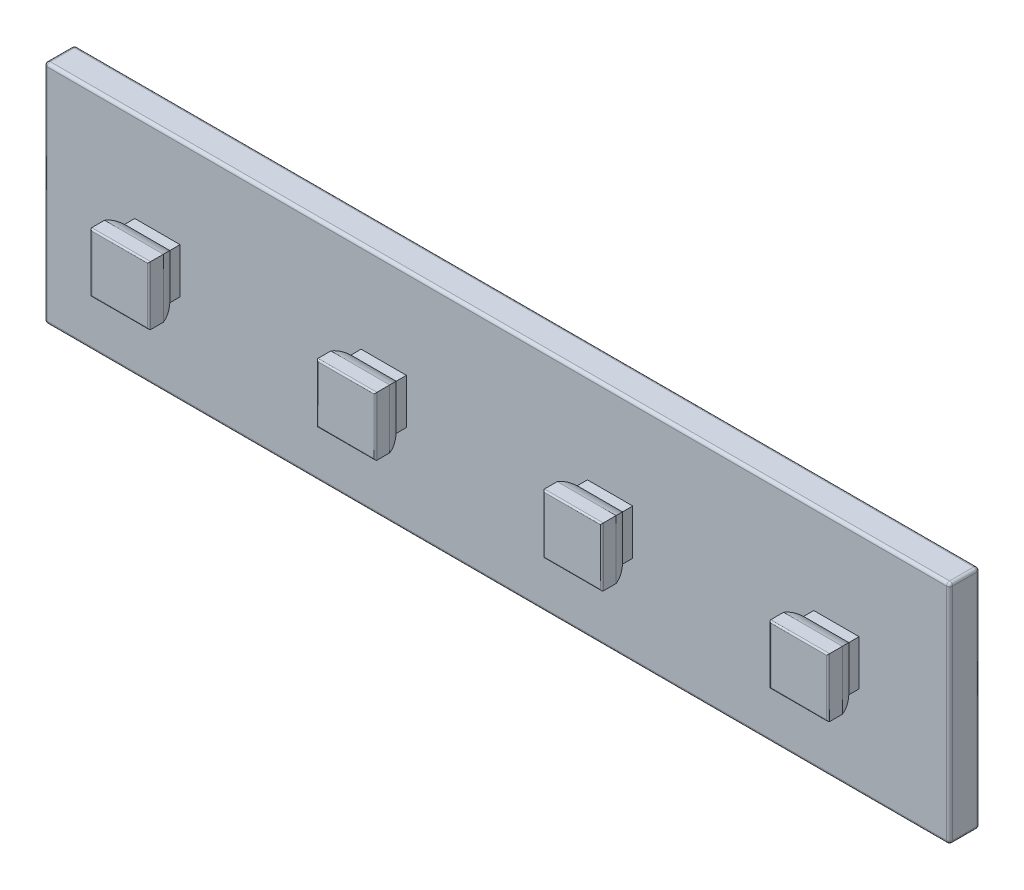
from build123d import *

# Parameters (mm, degrees)
SKETCH_1_W             = 60
SKETCH_1_H             = 15
EXTRUDE_1_DEPTH        = 2
SKETCH_2_W             = 3
SKETCH_2_H             = 3
EXTRUDE_2_DEPTH        = 1
EXTRUDE_3_DEPTH        = 2
CUT_EXTRUDE_1_REACH    = 42.234
SKETCH_4_W             = 0.944409721
SKETCH_4_H             = 0.05
FILLET_1_R             = 0.1
FILLET_1_OF_MIRROR_2_R = 0.1
FILLET_2_R             = 0.2


# Read off the part's stored shape, not the designer's step: 镜向3
with BuildPart() as part:
    # 草图1 → 凸台-拉伸1 (new body)
    with BuildSketch(Plane.XY):
        Rectangle(SKETCH_1_W, SKETCH_1_H)
    extrude(amount=-EXTRUDE_1_DEPTH)

    # 草图2 → 凸台-拉伸2 (add)
    with BuildSketch(Plane.XY):
        with Locations((-7.5, 0)):
            Rectangle(SKETCH_2_W, SKETCH_2_H)
    extrude_2 = extrude(amount=EXTRUDE_2_DEPTH)

    # 草图3 → 凸台-拉伸3 (add, symmetric)
    with BuildSketch(Plane(origin=(0, 0, 0), x_dir=(1, 0, 0), z_dir=(0, 1, 0))):
        with BuildLine():
            Line((-9.45, -2.5), (-5.55, -2.5))
            Line((-5.55, -2.5), (-5.55, -1.555590279))
            ThreePointArc((-5.55, -1.555590279), (-5.719957697, -1.088161527), (-6, -0.677124344))
            Line((-6, -0.677124344), (-9, -0.677124344))
            ThreePointArc((-9, -0.677124344), (-9.280042303, -1.088161527), (-9.45, -1.555590279))
            Line((-9.45, -1.555590279), (-9.45, -2.5))
        make_face()
    extrude_3 = extrude(amount=EXTRUDE_3_DEPTH, both=True)

    # 草图4 → 切除-拉伸1 (cut, up to next)
    with BuildSketch(Plane.ZY.offset(9.45), mode=Mode.PRIVATE) as cut_extrude_1_sk1:
        with BuildLine():
            Line((1.555590279, 1.95), (1.555590279, 2))
            Line((1.555590279, 2), (0.677124344, 2))
            Line((0.677124344, 2), (0.677124344, 1.5))
            ThreePointArc((0.677124344, 1.5), (1.088161527, 1.780042303), (1.555590279, 1.95))
        make_face()
    cut_extrude_1_tool1 = extrude(cut_extrude_1_sk1.sketch, amount=-CUT_EXTRUDE_1_REACH, mode=Mode.PRIVATE) & part.part
    # 草图4 → 切除-拉伸1 (cut, up to next)
    with BuildSketch(Plane.ZY.offset(9.45), mode=Mode.PRIVATE) as cut_extrude_1_sk2:
        with Locations((2.02779514, 1.975)):
            Rectangle(SKETCH_4_W, SKETCH_4_H)
    cut_extrude_1_tool2 = extrude(cut_extrude_1_sk2.sketch, amount=-CUT_EXTRUDE_1_REACH, mode=Mode.PRIVATE) & part.part
    # 草图4 → 切除-拉伸1 (cut, up to next)
    with BuildSketch(Plane.ZY.offset(9.45), mode=Mode.PRIVATE) as cut_extrude_1_sk3:
        with Locations((2.02779514, -1.975)):
            Rectangle(SKETCH_4_W, SKETCH_4_H)
    cut_extrude_1_tool3 = extrude(cut_extrude_1_sk3.sketch, amount=-CUT_EXTRUDE_1_REACH, mode=Mode.PRIVATE) & part.part
    # 草图4 → 切除-拉伸1 (cut, up to next)
    with BuildSketch(Plane.ZY.offset(9.45), mode=Mode.PRIVATE) as cut_extrude_1_sk4:
        with BuildLine():
            Line((1.555590279, -2), (1.555590279, -1.95))
            ThreePointArc((1.555590279, -1.95), (1.088161527, -1.780042303), (0.677124344, -1.5))
            Line((0.677124344, -1.5), (0.677124344, -2))
            Line((0.677124344, -2), (1.555590279, -2))
        make_face()
    cut_extrude_1_tool4 = extrude(cut_extrude_1_sk4.sketch, amount=-CUT_EXTRUDE_1_REACH, mode=Mode.PRIVATE) & part.part
    cut_extrude_1_1 = cut_extrude_1_tool1.solids().sort_by_distance((-9.45, 1.849056, 0.974505))[0]
    add(cut_extrude_1_1, mode=Mode.SUBTRACT)
    cut_extrude_1_2 = cut_extrude_1_tool2.solids().sort_by_distance((-9.45, 1.975, 2.027795))[0]
    add(cut_extrude_1_2, mode=Mode.SUBTRACT)
    cut_extrude_1_3 = cut_extrude_1_tool3.solids().sort_by_distance((-9.45, -1.975, 2.027795))[0]
    add(cut_extrude_1_3, mode=Mode.SUBTRACT)
    cut_extrude_1_4 = cut_extrude_1_tool4.solids().sort_by_distance((-9.45, -1.849056, 0.974505))[0]
    add(cut_extrude_1_4, mode=Mode.SUBTRACT)
    cut_extrude_1 = cut_extrude_1_1 + cut_extrude_1_2 + cut_extrude_1_3 + cut_extrude_1_4  # 切除-拉伸1 as one shape, for the pattern or mirror that repeats it

    # 圆角1
    fillet_1_edges = [part.edges().sort_by_distance(p)[0] for p in [
        (-7.5, 1.95, 2.5),
        (-9.45, 0, 2.5),
        (-5.55, 0, 2.5),
        (-7.5, -1.95, 2.5),
    ]]
    fillet(fillet_1_edges, radius=FILLET_1_R)

    # 镜向2: 凸台-拉伸2, 凸台-拉伸3, 切除-拉伸1 across plane
    add(extrude_2.mirror(Plane(origin=(-15, 0, 0), x_dir=(0, 0, 1), z_dir=(1, 0, 0))))
    add(extrude_3.mirror(Plane(origin=(-15, 0, 0), x_dir=(0, 0, 1), z_dir=(1, 0, 0))))
    add(cut_extrude_1.mirror(Plane(origin=(-15, 0, 0), x_dir=(0, 0, 1), z_dir=(1, 0, 0))), mode=Mode.SUBTRACT)

    # 圆角1 of 镜向2
    fillet_1_of_mirror_2_edges = [part.edges().sort_by_distance(p)[0] for p in [
        (-22.5, 1.95, 2.5),
        (-20.55, 0, 2.5),
        (-24.45, 0, 2.5),
        (-22.5, -1.95, 2.5),
    ]]
    fillet(fillet_1_of_mirror_2_edges, radius=FILLET_1_OF_MIRROR_2_R)

    # 镜向3: part across plane


with BuildPart() as part_1:
    add(part.part)
    add(part.part.mirror(Plane(origin=(0, 0, 0), x_dir=(0, 0, 1), z_dir=(1, 0, 0))))

    # 圆角2
    fillet_2_edges = [part_1.edges().sort_by_distance(p)[0] for p in [
        (30, 0, -2),
        (0, 7.5, -2),
        (-30, 0, -2),
        (0, 7.5, 0),
        (30, 0, 0),
        (0, -7.5, 0),
        (-30, 0, 0),
        (0, -7.5, -2),
        (-30, 7.5, -1),
        (30, 7.5, -1),
        (30, -7.5, -1),
        (-30, -7.5, -1),
    ]]
    fillet(fillet_2_edges, radius=FILLET_2_R)


solid = part_1.part
